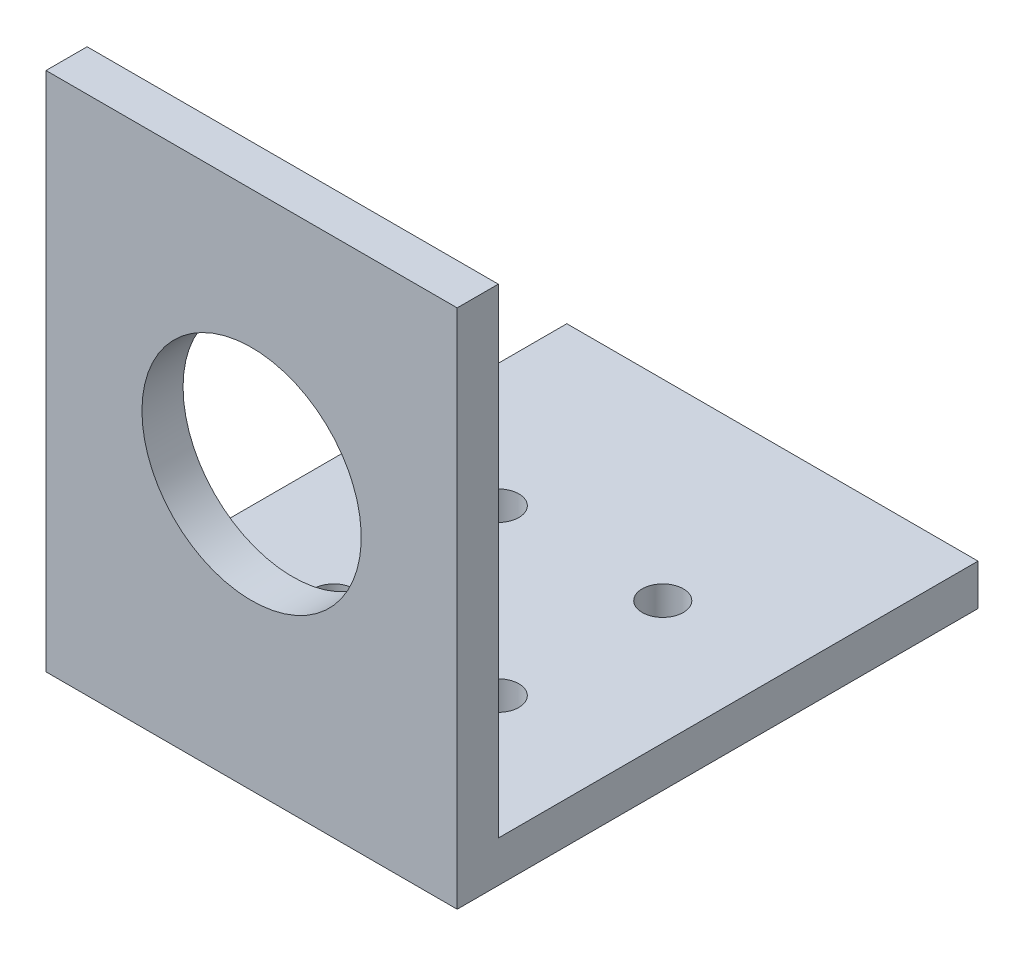
from build123d import *

# Parameters (mm, degrees)
EXTRUDE_1_DEPTH     = 20
SKETCH_3_R          = 1.5
CUT_EXTRUDE_1_DEPTH = 56.398555938
SKETCH_5_R          = 5
CUT_EXTRUDE_3_DEPTH = 56.398555938
SKETCH_8_R          = 8
CUT_EXTRUDE_4_DEPTH = 10
EXTRUDE_2_DEPTH     = 5
EXTRUDE_3_DEPTH     = 5


with BuildPart() as part:
    # 草图1 → 凸台-拉伸1 (new body)
    with BuildSketch(Plane(origin=(0, 0, 0), x_dir=(0, 0, -1), z_dir=(1, 0, 0))):
        Polygon((0, 0), (0, 38), (3, 38), (3, 3), (38, 3), (38, 0), align=None)
    extrude(amount=EXTRUDE_1_DEPTH)

    # 草图3 → 切除-拉伸1 (cut, through all)
    with BuildSketch(Plane(origin=(0, 3, 0), x_dir=(1, 0, 0), z_dir=(0, 1, 0))):
        with Locations((16, 12)):
            Circle(SKETCH_3_R)
        with Locations((4, 12)):
            Circle(SKETCH_3_R)
        with Locations((4, 24)):
            Circle(SKETCH_3_R)
        with Locations((16, 24)):
            Circle(SKETCH_3_R)
    extrude(amount=-CUT_EXTRUDE_1_DEPTH, mode=Mode.SUBTRACT)

    # 草图5 → 切除-拉伸3 (cut, through all)
    with BuildSketch(Plane(origin=(0, 0, -3), x_dir=(-1, 0, 0), z_dir=(0, 0, -1))):
        with Locations((-10, 20)):
            Circle(SKETCH_5_R)
    extrude(amount=-CUT_EXTRUDE_3_DEPTH, mode=Mode.SUBTRACT)

    # 草图8 → 切除-拉伸4 (cut)
    with BuildSketch(Plane(origin=(0, 0, -3), x_dir=(-1, 0, 0), z_dir=(0, 0, -1))):
        with Locations((-10, 20)):
            Circle(SKETCH_8_R)
    extrude(amount=-CUT_EXTRUDE_4_DEPTH, mode=Mode.SUBTRACT)

    # 草图9 → 凸台-拉伸2 (add)
    with BuildSketch(Plane(origin=(20, 0, 0), x_dir=(0, 0, -1), z_dir=(1, 0, 0))):
        Polygon((3, 38), (0, 38), (0, 0), (38, 0), (38, 3), (3, 3), align=None)
    extrude(amount=EXTRUDE_2_DEPTH)

    # 草图10 → 凸台-拉伸3 (add)
    with BuildSketch(Plane.ZY):
        Polygon((0, 38), (-3, 38), (-3, 3), (-38, 3), (-38, 0), (0, 0), align=None)
    extrude(amount=EXTRUDE_3_DEPTH)


solid = part.part
